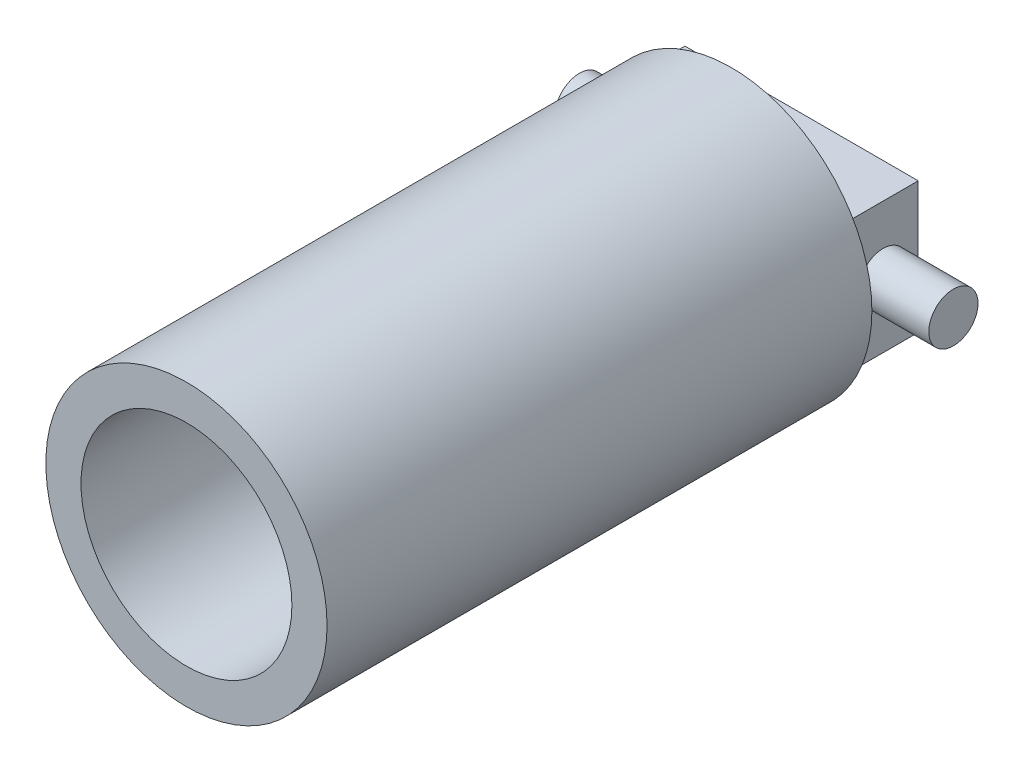
from build123d import *

# Parameters (mm, degrees)
SKETCH2_R           = 10.674295377
CUT_EXTRUDE1_DEPTH  = 1.27
SKETCH3_W           = 16.858270558
SKETCH3_H           = 9.490145314
BOSS_EXTRUDE1_DEPTH = 5.08
SKETCH4_R           = 1.778
BOSS_EXTRUDE2_DEPTH = 5.08
BOSS_EXTRUDE3_START = 5.08
SKETCH5_R           = 1.778
BOSS_EXTRUDE3_DEPTH = 5.08


# Read off the part's stored shape, not the designer's step: Extrude-Thin1
with BuildPart() as part:
    # Extrude-Thin1 outline → Extrude-Thin1 (revolve)
    with BuildSketch(Plane.XZ):
        Polygon((10.16, 40.64), (0, 40.64), (0, 39.64), (7.62, 39.64), (7.62, 1), (0, 1), (0, 0), (10.16, 0), align=None)
    revolve(axis=Axis((0, 0, 0), (0, 0, 1)))

    # Sketch2 → Cut-Extrude1 (cut)
    with BuildSketch(Plane.XY.offset(40.64)):
        Circle(SKETCH2_R)
    extrude(amount=-CUT_EXTRUDE1_DEPTH, mode=Mode.SUBTRACT)

    # Sketch3 → Boss-Extrude1 (add)
    with BuildSketch(Plane(origin=(0, 0, 0), x_dir=(-1, 0, 0), z_dir=(0, 0, -1))):
        Rectangle(SKETCH3_W, SKETCH3_H)
    extrude(amount=BOSS_EXTRUDE1_DEPTH)

    # Sketch4 → Boss-Extrude2 (add)
    with BuildSketch(Plane.ZY.offset(8.429135279)):
        with Locations(Location((-2.54, 0, 0), (0, 0, 180))):
            Circle(SKETCH4_R)
    extrude(amount=BOSS_EXTRUDE2_DEPTH)

    # Sketch5 → Boss-Extrude3 (add)
    with BuildSketch(Plane(origin=(8.429135279, 0, 0), x_dir=(0, 0, -1), z_dir=(1, 0, 0)).offset(BOSS_EXTRUDE3_START)):
        with Locations((2.54, 0)):
            Circle(SKETCH5_R)
    extrude(amount=-BOSS_EXTRUDE3_DEPTH)


solid = part.part
